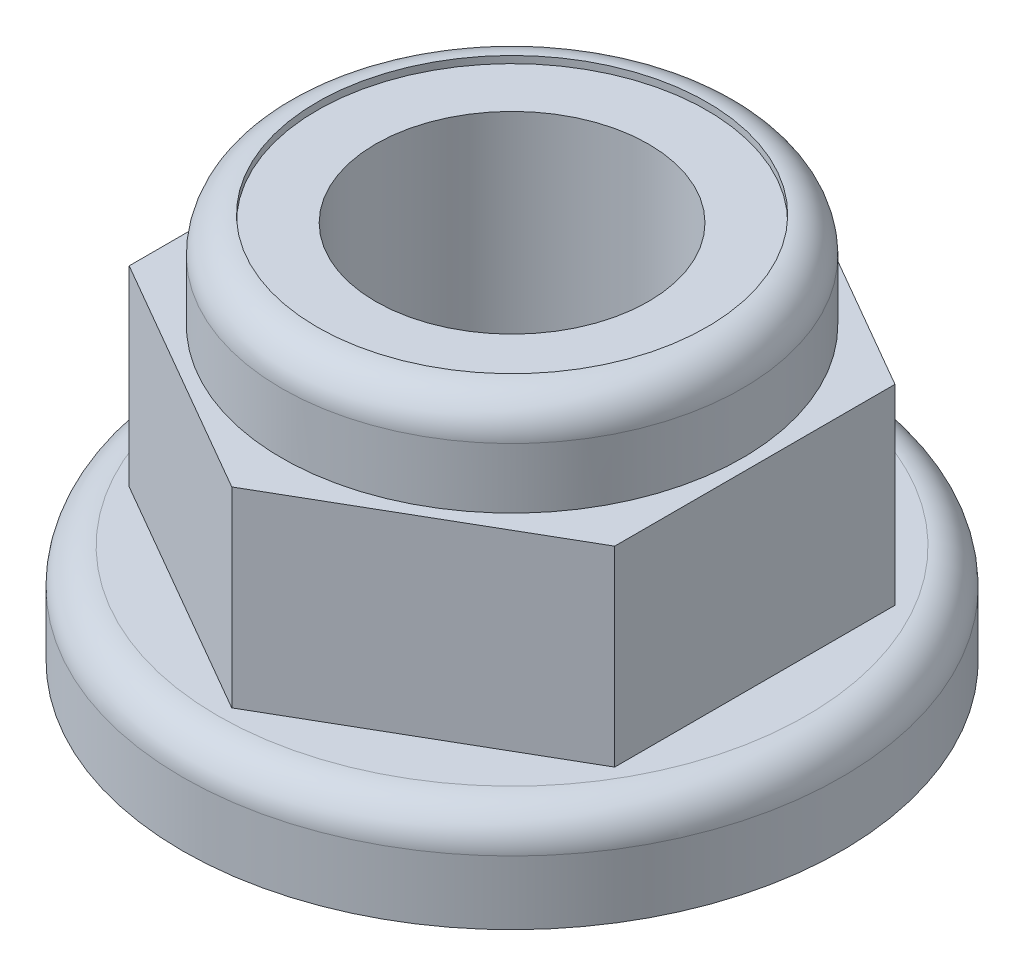
from build123d import *

# Parameters (mm, degrees)
SKETCH1_R           = 4.65
BOSS_EXTRUDE1_DEPTH = 1.4
BOSS_EXTRUDE2_DEPTH = 2.7
SKETCH3_R           = 3.25
BOSS_EXTRUDE3_DEPTH = 1.35
FILLET1_R           = 0.5
CUT_EXTRUDE1_REACH  = 10.541
SKETCH7_R           = 1.925
SKETCH8_R           = 2.75
SKETCH8_R_2         = 1.925
CUT_EXTRUDE2_DEPTH  = 0.1


with BuildPart() as part:
    # Sketch1 → Boss-Extrude1 (new body)
    with BuildSketch(Plane(origin=(0, 0, 0), x_dir=(1, 0, 0), z_dir=(0, 1, 0))):
        Circle(SKETCH1_R)
    extrude(amount=BOSS_EXTRUDE1_DEPTH)

    # Sketch2 → Boss-Extrude2 (add)
    with BuildSketch(Plane(origin=(0, 1.4, 0), x_dir=(1, 0, 0), z_dir=(0, 1, 0))):
        Polygon((0, -3.954849344), (3.425, -1.977424672), (3.425, 1.977424672), (0, 3.954849344), (-3.425, 1.977424672), (-3.425, -1.977424672), align=None)
    extrude(amount=BOSS_EXTRUDE2_DEPTH)

    # Sketch3 → Boss-Extrude3 (add)
    with BuildSketch(Plane(origin=(0, 4.1, 0), x_dir=(1, 0, 0), z_dir=(0, 1, 0))):
        Circle(SKETCH3_R)
    extrude(amount=BOSS_EXTRUDE3_DEPTH)

    # Fillet1
    fillet1_edges = [part.edges().sort_by_distance(p)[0] for p in [
        (-3.25, 5.45, 0),
        (-4.65, 1.4, 0),
    ]]
    fillet(fillet1_edges, radius=FILLET1_R)

    # Sketch7 → Cut-Extrude1 (cut, up to next)
    with BuildSketch(Plane(origin=(0, 5.45, 0), x_dir=(1, 0, 0), z_dir=(0, 1, 0)), mode=Mode.PRIVATE) as cut_extrude1_sk1:
        Circle(SKETCH7_R)
    cut_extrude1_tool1 = extrude(cut_extrude1_sk1.sketch, amount=-CUT_EXTRUDE1_REACH, mode=Mode.PRIVATE) & part.part
    add(cut_extrude1_tool1.solids().sort_by_distance((0, 5.45, 0))[0], mode=Mode.SUBTRACT)

    # Sketch8 → Cut-Extrude2 (cut)
    with BuildSketch(Plane(origin=(0, 5.45, 0), x_dir=(1, 0, 0), z_dir=(0, 1, 0))):
        Circle(SKETCH8_R)
        Circle(SKETCH8_R_2, mode=Mode.SUBTRACT)
    extrude(amount=-CUT_EXTRUDE2_DEPTH, mode=Mode.SUBTRACT)


solid = part.part
